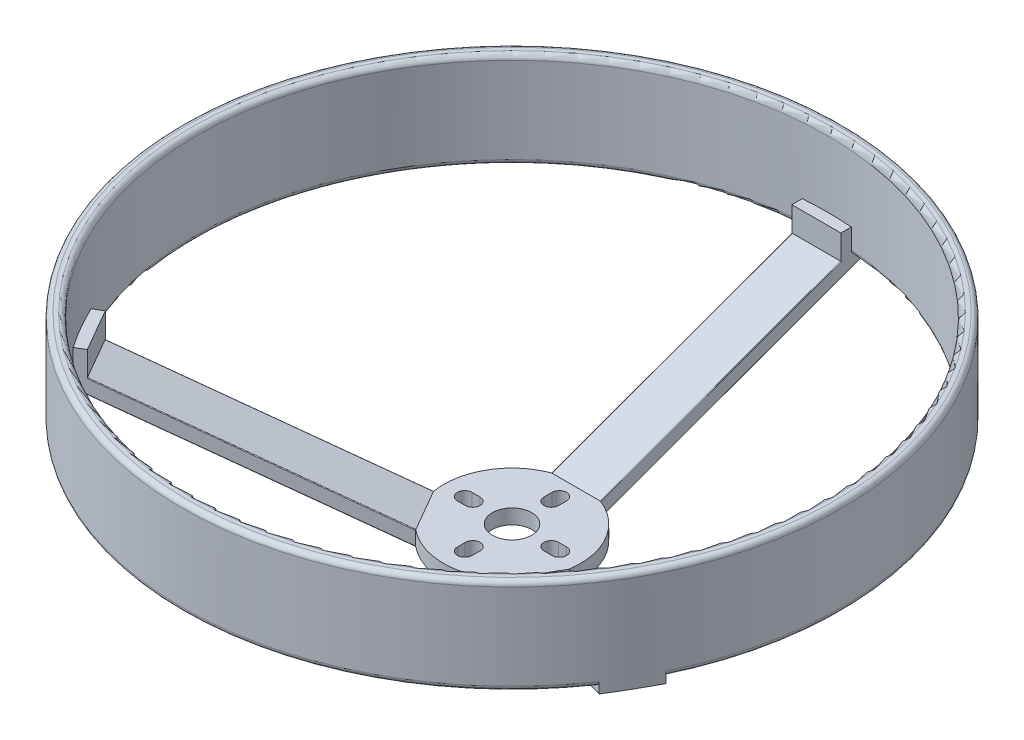
from build123d import *

# Parameters (mm, degrees)
SKETCH1_R               = 13.95
BOSS_EXTRUDE1_DEPTH     = 1.5
SKETCH2_R               = 4
CUT_EXTRUDE1_DEPTH      = 20.955074542581894
SKETCH3_R               = 1.4999999999999987
SKETCH3_R_2             = 1.5000000000000002
SKETCH3_R_3             = 1.4999999999999998
SKETCH3_W               = 10
SKETCH3_H               = 9.999999999999998
CUT_EXTRUDE2_DEPTH      = 20.955074542581894
CIRPATTERN1_COUNT       = 3
SKETCH6_R               = 100
CUT_EXTRUDE3_DEPTH      = 7.5
SKETCH7_R               = 70.00000000000001
SKETCH7_R_2             = 64.31
BOSS_EXTRUDE2_DEPTH     = 7
BOSS_EXTRUDE3_DEPTH     = 7
FILLET2_R               = 0.125
CUT_EXTRUDE4_START      = -7
CUT_EXTRUDE4_DEPTH      = 7
CUT_EXTRUDE5_DEPTH      = 103.99412000675751
CUT_EXTRUDE5_DEPTH_BACK = 103.99412000675751
SKETCH14_R              = 67.13
SKETCH15_R              = 67.13
SKETCH15_R_2            = 64.31
BOSS_EXTRUDE4_DEPTH     = 12.5
BOSS_EXTRUDE5_DEPTH     = 5
FILLET3_R               = 1
FILLET4_R               = 1
CUT_EXTRUDE6_DEPTH      = 103.00993873792338
CUT_EXTRUDE6_DEPTH_BACK = 103.00993873792338
SKETCH17_R              = 1.4999999999999993
SKETCH17_R_2            = 1.4999999999999987
SKETCH17_R_3            = 1.5000000000000293
SKETCH17_R_4            = 1.5000000000000002
SKETCH17_R_5            = 1.5000000000000078
SKETCH17_R_6            = 1.5
SKETCH17_R_7            = 1.4999999999999996
SKETCH17_R_8            = 1.4999999999999991


with BuildPart() as part:
    # Sketch1 → Boss-Extrude1 (new, symmetric)
    with BuildSketch(Plane(origin=(0, 0, 0), x_dir=(1, 0, 0), z_dir=(0, 1, 0))):
        with Locations(Location((0, 0, 0), (0, 0, 270))):
            Circle(SKETCH1_R)
    extrude(amount=BOSS_EXTRUDE1_DEPTH, both=True)

    # Sketch2 → Cut-Extrude1 (cut, through all)
    with BuildSketch(Plane(origin=(0, 1.5, 0), x_dir=(1, 0, 0), z_dir=(0, 1, 0))):
        with Locations(Location((0, 0, 0), (0, 0, 270))):
            Circle(SKETCH2_R)
    extrude(amount=-CUT_EXTRUDE1_DEPTH, mode=Mode.SUBTRACT)

    # Sketch3 → Cut-Extrude2 (cut, through all)
    with BuildSketch(Plane(origin=(0, 1.5, 0), x_dir=(1, 0, 0), z_dir=(0, 1, 0))):
        with Locations(Location((-9.63, 0, 0), (0, 0, 270))):
            Circle(SKETCH3_R)
        with Locations(Location((0, -8, 0), (0, 0, 270))):
            Circle(SKETCH3_R_2)
        with Locations(Location((0, 8, 0), (0, 0, 270))):
            Circle(SKETCH3_R_3)
        with Locations(Location((9.63, 0, 0), (0, 0, 270))):
            Circle(SKETCH3_R)
        with Locations((0, 18.023152460138057)):
            Rectangle(SKETCH3_W, SKETCH3_H)
        Polygon((13.778380867837367, -2.181449211146851), (8.778380867837354, -10.841703248991234), (17.43863490568173, -15.841703248991243), (22.43863490568175, -7.181449211146856), align=None)
        Polygon((-13.778380867837367, -2.181449211146851), (-8.778380867837354, -10.841703248991234), (-17.43863490568173, -15.841703248991246), (-22.438634905681745, -7.181449211146867), align=None)
    extrude(amount=-CUT_EXTRUDE2_DEPTH, mode=Mode.SUBTRACT)

    # Sweep1: sweep along a path in Sketch4
    with BuildLine(Plane(origin=(0, 0, 0), x_dir=(0, 0, -1), z_dir=(1, 0, 0))) as sweep1_path:
        Line((13.023152460138059, -1.5), (82.60294999917723, 23.824975210479074))
    # Sketch5 → Sweep1 (sweep)
    with BuildSketch(Plane(origin=(0, 0, -13.023152460138059), x_dir=(-1, 0, 0), z_dir=(0, 0, -1))):
        Polygon((5, 1.5), (-5, 1.5), (-4.999999999999998, -1.5), (5, -1.5), align=None)
    sweep1 = sweep(path=sweep1_path.line)

    # CirPattern1: Sweep1 ×3 about axis
    cirpattern1_axis = Axis((-3.73e-15, 0, 7.27e-15), (0, 1, 0))
    for i in range(1, CIRPATTERN1_COUNT):
        add(sweep1.rotate(cirpattern1_axis, i * 360 / CIRPATTERN1_COUNT))

    # Sketch6 → Cut-Extrude3 (cut)
    with BuildSketch(Plane(origin=(2.6e-15, 26.824975210479078, -7.5e-16), x_dir=(1, -1.2e-16, 0), z_dir=(1.2e-16, 1, -4e-17))):
        Circle(SKETCH6_R)
    extrude(amount=-CUT_EXTRUDE3_DEPTH, mode=Mode.SUBTRACT)

    # Sketch7 → Boss-Extrude2 (add)
    with BuildSketch(Plane(origin=(2.34e-15, 19.32497521047908, -8.1e-16), x_dir=(1, -1.2e-16, 0), z_dir=(1.2e-16, 1, -4e-17))):
        with Locations(Location((0, 0, 0), (0, 0, 334.096043758))):
            Circle(SKETCH7_R)
        with Locations(Location((0, 0, 0), (0, 0, 334.459155717))):
            Circle(SKETCH7_R_2, mode=Mode.SUBTRACT)
    extrude(amount=BOSS_EXTRUDE2_DEPTH)

    # Sketch8 → Boss-Extrude3 (add)
    with BuildSketch(Plane(origin=(2.34e-15, 19.32497521047908, -8.1e-16), x_dir=(1, -1.2e-16, 0), z_dir=(1.2e-16, 1, -4e-17))):
        with BuildLine():
            Line((-62.966933112239, -30.58047309050046), (-63.32901953974998, -30.78952378689385))
            Line((-63.32901953974998, -30.78952378689385), (-58.32901953974994, -39.44977782473821))
            Line((-58.32901953974994, -39.44977782473821), (-57.96693311223896, -39.24072712834482))
            ThreePointArc((-57.96693311223896, -39.24072712834482), (-60.62177826491057, -35.00000000000027), (-62.966933112239, -30.58047309050046))
        make_face()
        with BuildLine():
            Line((-56.19086381503456, -26.668307657711885), (-58.02550832725429, -27.72754016070923))
            ThreePointArc((-58.02550832725429, -27.72754016070923), (-55.6940937173771, -32.15500000000027), (-53.025508327254265, -36.3877941985536))
            Line((-53.025508327254265, -36.3877941985536), (-51.190863815034525, -35.328561695556246))
            Line((-51.190863815034525, -35.328561695556246), (-56.19086381503456, -26.668307657711885))
        make_face()
        with BuildLine():
            Line((4.999999999999997, 61.996869353267606), (4.999999999999996, 64.11533435926229))
            ThreePointArc((4.999999999999996, 64.11533435926229), (3.94e-15, 64.31), (-5.000000000000003, 64.1153343592623))
            Line((-5.000000000000003, 64.1153343592623), (-5.000000000000003, 61.996869353267606))
            Line((-5.000000000000003, 61.996869353267606), (4.999999999999997, 61.996869353267606))
        make_face()
        with BuildLine():
            Line((4.999999999999997, 69.82120021884472), (4.999999999999996, 70.23930161163146))
            Line((4.999999999999996, 70.23930161163146), (-5.0000000000000036, 70.23930161163146))
            Line((-5.0000000000000036, 70.23930161163146), (-5.000000000000003, 69.82120021884472))
            ThreePointArc((-5.000000000000003, 69.82120021884472), (4.29e-15, 70.00000000000001), (4.999999999999997, 69.82120021884472))
        make_face()
        with BuildLine():
            Line((57.96693311223951, -39.24072712834403), (58.32901953975044, -39.44977782473735))
            Line((58.32901953975044, -39.44977782473735), (63.32901953975037, -30.789523786892925))
            Line((63.32901953975037, -30.789523786892925), (62.96693311223943, -30.58047309049959))
            ThreePointArc((62.96693311223943, -30.58047309049959), (60.62177826491105, -34.99999999999945), (57.96693311223951, -39.24072712834403))
        make_face()
        with BuildLine():
            Line((51.19086381503499, -35.32856169555552), (53.02550832725476, -36.38779419855285))
            ThreePointArc((53.02550832725476, -36.38779419855285), (55.69409371737755, -32.15499999999948), (58.0255083272547, -27.727540160708426))
            Line((58.0255083272547, -27.727540160708426), (56.190863815034895, -26.668307657711075))
            Line((56.190863815034895, -26.668307657711075), (51.19086381503499, -35.32856169555552))
        make_face()
    extrude(amount=BOSS_EXTRUDE3_DEPTH)

    # Fillet2
    # the kernel refuses this fillet: 0.125 mm, written as the material it takes off along each edge
    with BuildSketch(Plane(origin=(-5, 1.3931187052107246, -12.729498516142453), x_dir=(1, 1.57e-15, 5.7e-16), z_dir=(0, 0.34202014332566916, -0.9396926207859083))) as fillet2_piece_1_section:
        with BuildLine():
            CenterArc((FILLET2_R, FILLET2_R), FILLET2_R, 180.00000000000085, 89.9999999999992)
            Line((-2.1e-16, FILLET2_R), (0, 0))
            Line((0, 0), (FILLET2_R, 0))
        make_face()
    fillet2_piece_1 = extrude(amount=52.74174095319662, mode=Mode.PRIVATE)
    fillet2_piece_1 = split(fillet2_piece_1, bisect_by=Plane(origin=(-4.98919132777138, 1.5, -13.108384860201912), z_dir=(0, -1, 0)), keep=Keep.TOP, mode=Mode.PRIVATE)
    fillet2_piece_1 = fillet2_piece_1 - Plane(origin=(0, 1.470483975860823, 0), x_dir=(-1.8e-16, 0, 1), z_dir=(0, 1, 0)) * Cylinder(13.95, 106, mode=Mode.PRIVATE)
    add(fillet2_piece_1, mode=Mode.SUBTRACT)
    with BuildSketch(Plane(origin=(-5, 1.3931187052107246, -12.729498516142453), x_dir=(1, 1.57e-15, 5.7e-16), z_dir=(0, 0.34202014332566916, -0.9396926207859083))) as fillet2_piece_2_section:
        with BuildLine():
            CenterArc((FILLET2_R, FILLET2_R), FILLET2_R, 180.00000000000085, 89.9999999999992)
            Line((-2.1e-16, FILLET2_R), (0, 0))
            Line((0, 0), (FILLET2_R, 0))
        make_face()
    fillet2_piece_2 = extrude(amount=52.74174095319662, mode=Mode.PRIVATE)
    fillet2_piece_2 = split(fillet2_piece_2, bisect_by=Plane(origin=(-4.92233777010117, 1.5, -13.038493601413808), z_dir=(0, 1, 0)), keep=Keep.TOP, mode=Mode.PRIVATE)
    fillet2_piece_2 = fillet2_piece_2 & Plane(origin=(0, 1.505160465180015, 0), x_dir=(-1.8e-16, 0, 1), z_dir=(0, 1, 0)) * Cylinder(13.95, 106, mode=Mode.PRIVATE)
    add(fillet2_piece_2, mode=Mode.SUBTRACT)
    with BuildSketch(Plane(origin=(-5, 1.3931187052107246, -12.729498516142453), x_dir=(1, 1.57e-15, 5.7e-16), z_dir=(0, 0.34202014332566916, -0.9396926207859083))) as fillet2_piece_3_section:
        with BuildLine():
            CenterArc((FILLET2_R, FILLET2_R), FILLET2_R, 180.00000000000085, 89.9999999999992)
            Line((-2.1e-16, FILLET2_R), (0, 0))
            Line((0, 0), (FILLET2_R, 0))
        make_face()
    fillet2_piece_3 = extrude(amount=52.74174095319662, mode=Mode.PRIVATE)
    fillet2_piece_3 = split(fillet2_piece_3, bisect_by=Plane(origin=(-4.971679062367054, 1.5, -37.55335887721227), z_dir=(0, 1, 0)), keep=Keep.TOP, mode=Mode.PRIVATE)
    fillet2_piece_3 = split(fillet2_piece_3, bisect_by=Plane(origin=(-4.971679062367053, 10.398193142999142, -61.996869353267606), z_dir=(0, 4e-17, 1)), keep=Keep.TOP, mode=Mode.PRIVATE)
    fillet2_piece_3 = fillet2_piece_3 - Plane(origin=(0, 10.398193142999144, 0), x_dir=(-1.8e-16, 0, 1), z_dir=(0, 1, 0)) * Cylinder(13.95, 106, mode=Mode.PRIVATE)
    add(fillet2_piece_3, mode=Mode.SUBTRACT)
    with BuildSketch(Plane(origin=(5, 1.3931187052107246, -12.729498516142453), x_dir=(-1, 1.57e-15, 5.7e-16), z_dir=(0, 0.34202014332566916, -0.9396926207859083))) as fillet2_piece_4_section:
        with BuildLine():
            CenterArc((FILLET2_R, -FILLET2_R), FILLET2_R, 89.99999999999991, 90)
            Line((-2.1e-16, -FILLET2_R), (0, 0))
            Line((0, 0), (FILLET2_R, 0))
        make_face()
    fillet2_piece_4 = extrude(amount=52.74174095319662, mode=Mode.PRIVATE)
    fillet2_piece_4 = split(fillet2_piece_4, bisect_by=Plane(origin=(4.989191288768681, 1.5, -13.108384765845637), z_dir=(0, -1, 0)), keep=Keep.TOP, mode=Mode.PRIVATE)
    fillet2_piece_4 = fillet2_piece_4 - Plane(origin=(0, 1.4704838861363334, 0), x_dir=(-1.8e-16, 0, 1), z_dir=(0, 1, 0)) * Cylinder(13.95, 106, mode=Mode.PRIVATE)
    add(fillet2_piece_4, mode=Mode.SUBTRACT)
    with BuildSketch(Plane(origin=(5, 1.3931187052107246, -12.729498516142453), x_dir=(-1, 1.57e-15, 5.7e-16), z_dir=(0, 0.34202014332566916, -0.9396926207859083))) as fillet2_piece_5_section:
        with BuildLine():
            CenterArc((FILLET2_R, -FILLET2_R), FILLET2_R, 89.99999999999991, 90)
            Line((-2.1e-16, -FILLET2_R), (0, 0))
            Line((0, 0), (FILLET2_R, 0))
        make_face()
    fillet2_piece_5 = extrude(amount=52.74174095319662, mode=Mode.PRIVATE)
    fillet2_piece_5 = split(fillet2_piece_5, bisect_by=Plane(origin=(4.922337773960496, 1.5, -13.038493603324556), z_dir=(0, 1, 0)), keep=Keep.TOP, mode=Mode.PRIVATE)
    fillet2_piece_5 = fillet2_piece_5 & Plane(origin=(0, 1.505160464078921, 0), x_dir=(-1.8e-16, 0, 1), z_dir=(0, 1, 0)) * Cylinder(13.95, 106, mode=Mode.PRIVATE)
    add(fillet2_piece_5, mode=Mode.SUBTRACT)
    with BuildSketch(Plane(origin=(5, 1.3931187052107246, -12.729498516142453), x_dir=(-1, 1.57e-15, 5.7e-16), z_dir=(0, 0.34202014332566916, -0.9396926207859083))) as fillet2_piece_6_section:
        with BuildLine():
            CenterArc((FILLET2_R, -FILLET2_R), FILLET2_R, 89.99999999999991, 90)
            Line((-2.1e-16, -FILLET2_R), (0, 0))
            Line((0, 0), (FILLET2_R, 0))
        make_face()
    fillet2_piece_6 = extrude(amount=52.74174095319662, mode=Mode.PRIVATE)
    fillet2_piece_6 = split(fillet2_piece_6, bisect_by=Plane(origin=(4.971679061604045, 1.5, -37.55335844838123), z_dir=(0, 1, 0)), keep=Keep.TOP, mode=Mode.PRIVATE)
    fillet2_piece_6 = fillet2_piece_6 - Plane(origin=(0, 10.398192987204272, 0), x_dir=(-1.8e-16, 0, 1), z_dir=(0, 1, 0)) * Cylinder(13.95, 106, mode=Mode.PRIVATE)
    fillet2_piece_6 = split(fillet2_piece_6, bisect_by=Plane(origin=(4.9716790616040445, 10.398192987204268, -61.996869353267606), z_dir=(0, 4e-17, 1)), keep=Keep.TOP, mode=Mode.PRIVATE)
    add(fillet2_piece_6, mode=Mode.SUBTRACT)
    with BuildSketch(Plane(origin=(4.999999999999998, -1.6068812947892759, -12.729498516142453), x_dir=(-1, 3.14e-15, 1.14e-15), z_dir=(0, 0.34202014332566916, -0.9396926207859083))) as fillet2_piece_7_section:
        with BuildLine():
            CenterArc((FILLET2_R, FILLET2_R), FILLET2_R, 180.0000000000001, 89.99999999999972)
            Line((4.2e-16, FILLET2_R), (0, 0))
            Line((0, 0), (FILLET2_R, 0))
        make_face()
    fillet2_piece_7 = extrude(amount=61.51315415368586, mode=Mode.PRIVATE)
    fillet2_piece_7 = fillet2_piece_7 - Plane(origin=(0, 8.996247599581329, 0), x_dir=(-1.8e-16, 0, 1), z_dir=(0, 1, 0)) * Cylinder(13.95, 124, mode=Mode.PRIVATE)
    add(fillet2_piece_7, mode=Mode.SUBTRACT)
    with BuildSketch(Plane(origin=(-5, -1.6068812947892757, -12.729498516142453), x_dir=(1, 1.57e-15, 5.7e-16), z_dir=(0, 0.34202014332566916, -0.9396926207859083))) as fillet2_piece_8_section:
        with BuildLine():
            CenterArc((FILLET2_R, -FILLET2_R), FILLET2_R, 90.0000000000001, 90.00000000000045)
            Line((2.1e-16, -FILLET2_R), (0, 0))
            Line((0, 0), (FILLET2_R, 0))
        make_face()
    fillet2_piece_8 = extrude(amount=61.51315415368586, mode=Mode.PRIVATE)
    fillet2_piece_8 = fillet2_piece_8 - Plane(origin=(0, 8.996244984168513, 0), x_dir=(-1.8e-16, 0, 1), z_dir=(0, 1, 0)) * Cylinder(13.95, 124, mode=Mode.PRIVATE)
    add(fillet2_piece_8, mode=Mode.SUBTRACT)
    with BuildSketch(Plane(origin=(-8.52406909241569, 1.393118705210723, 10.694876276993423), x_dir=(-0.2961981327260264, -0.9396926207859082, 0.17101007166283072), z_dir=(-0.8137976813493737, 0.34202014332566916, 0.46984631039295394))) as fillet2_piece_9_section:
        with BuildLine():
            CenterArc((FILLET2_R, -FILLET2_R), FILLET2_R, 90.0000000000003, 90.00000000000006)
            Line((7.7e-16, -FILLET2_R), (0, 0))
            Line((0, 0), (FILLET2_R, 0))
        make_face()
    fillet2_piece_9 = extrude(amount=52.74174095319667, mode=Mode.PRIVATE)
    fillet2_piece_9 = fillet2_piece_9 & Plane(origin=(0, 1.505160465125439, 0), x_dir=(-1.8e-16, 0, 1), z_dir=(0, 1, 0)) * Cylinder(13.95, 106, mode=Mode.PRIVATE)
    fillet2_piece_9 = split(fillet2_piece_9, bisect_by=Plane(origin=(-8.830497788467238, 1.5, 10.782116361851354), z_dir=(0, 1, 0)), keep=Keep.TOP, mode=Mode.PRIVATE)
    add(fillet2_piece_9, mode=Mode.SUBTRACT)
    with BuildSketch(Plane(origin=(-8.52406909241569, 1.393118705210723, 10.694876276993423), x_dir=(-0.2961981327260264, -0.9396926207859082, 0.17101007166283072), z_dir=(-0.8137976813493737, 0.34202014332566916, 0.46984631039295394))) as fillet2_piece_10_section:
        with BuildLine():
            CenterArc((FILLET2_R, -FILLET2_R), FILLET2_R, 90.0000000000003, 90.00000000000006)
            Line((7.7e-16, -FILLET2_R), (0, 0))
            Line((0, 0), (FILLET2_R, 0))
        make_face()
    fillet2_piece_10 = extrude(amount=52.74174095319667, mode=Mode.PRIVATE)
    fillet2_piece_10 = fillet2_piece_10 - Plane(origin=(0, 1.470484023730546, 0), x_dir=(-1.8e-16, 0, 1), z_dir=(0, 1, 0)) * Cylinder(13.95, 106, mode=Mode.PRIVATE)
    fillet2_piece_10 = split(fillet2_piece_10, bisect_by=Plane(origin=(-8.857598660070193, 1.5, 10.874958902155365), z_dir=(0, -1, 0)), keep=Keep.TOP, mode=Mode.PRIVATE)
    add(fillet2_piece_10, mode=Mode.SUBTRACT)
    with BuildSketch(Plane(origin=(-8.52406909241569, 1.393118705210723, 10.694876276993423), x_dir=(-0.2961981327260264, -0.9396926207859082, 0.17101007166283072), z_dir=(-0.8137976813493737, 0.34202014332566916, 0.46984631039295394))) as fillet2_piece_11_section:
        with BuildLine():
            CenterArc((FILLET2_R, -FILLET2_R), FILLET2_R, 90.0000000000003, 90.00000000000006)
            Line((7.7e-16, -FILLET2_R), (0, 0))
            Line((0, 0), (FILLET2_R, 0))
        make_face()
    fillet2_piece_11 = extrude(amount=52.74174095319667, mode=Mode.PRIVATE)
    fillet2_piece_11 = fillet2_piece_11 - Plane(origin=(0, 10.39819312312159, 0), x_dir=(-1.8e-16, 0, 1), z_dir=(0, 1, 0)) * Cylinder(13.95, 106, mode=Mode.PRIVATE)
    fillet2_piece_11 = split(fillet2_piece_11, bisect_by=Plane(origin=(-30.03632320741014, 1.5, 23.082279778424425), z_dir=(0, 1, 0)), keep=Keep.TOP, mode=Mode.PRIVATE)
    fillet2_piece_11 = split(fillet2_piece_11, bisect_by=Plane(origin=(-51.20502428419945, 10.398193123121592, 35.30403504350358), z_dir=(0.8660254037844365, 0, -0.5000000000000039)), keep=Keep.TOP, mode=Mode.PRIVATE)
    add(fillet2_piece_11, mode=Mode.SUBTRACT)
    with BuildSketch(Plane(origin=(-13.524069092415694, 1.3931187052107243, 2.0346222391490354), x_dir=(0.5000000000000008, 3.1165301514669253e-15, 0.8660254037844383), z_dir=(-0.8137976813493737, 0.34202014332566916, 0.46984631039295394))) as fillet2_piece_12_section:
        with BuildLine():
            CenterArc((FILLET2_R, -FILLET2_R), FILLET2_R, 89.99999999999997, 89.99999999999918)
            Line((-1.87e-15, -FILLET2_R), (0, 0))
            Line((0, 0), (FILLET2_R, 0))
        make_face()
    fillet2_piece_12 = extrude(amount=52.74174095319667, mode=Mode.PRIVATE)
    fillet2_piece_12 = split(fillet2_piece_12, bisect_by=Plane(origin=(-13.846789875580967, 1.5, 2.2334259907132044), z_dir=(0, -1, 0)), keep=Keep.TOP, mode=Mode.PRIVATE)
    fillet2_piece_12 = fillet2_piece_12 - Plane(origin=(0, 1.470483895441978, 0), x_dir=(-1.8e-16, 0, 1), z_dir=(0, 1, 0)) * Cylinder(13.95, 106, mode=Mode.PRIVATE)
    add(fillet2_piece_12, mode=Mode.SUBTRACT)
    with BuildSketch(Plane(origin=(-13.524069092415694, 1.3931187052107243, 2.0346222391490354), x_dir=(0.5000000000000008, 3.1165301514669253e-15, 0.8660254037844383), z_dir=(-0.8137976813493737, 0.34202014332566916, 0.46984631039295394))) as fillet2_piece_13_section:
        with BuildLine():
            CenterArc((FILLET2_R, -FILLET2_R), FILLET2_R, 89.99999999999997, 89.99999999999918)
            Line((-1.87e-15, -FILLET2_R), (0, 0))
            Line((0, 0), (FILLET2_R, 0))
        make_face()
    fillet2_piece_13 = extrude(amount=52.74174095319667, mode=Mode.PRIVATE)
    fillet2_piece_13 = split(fillet2_piece_13, bisect_by=Plane(origin=(-13.752835574425907, 1.5, 2.2563772427188282), z_dir=(0, 1, 0)), keep=Keep.TOP, mode=Mode.PRIVATE)
    fillet2_piece_13 = fillet2_piece_13 & Plane(origin=(0, 1.5051604641850476, 0), x_dir=(-1.8e-16, 0, 1), z_dir=(0, 1, 0)) * Cylinder(13.95, 106, mode=Mode.PRIVATE)
    add(fillet2_piece_13, mode=Mode.SUBTRACT)
    with BuildSketch(Plane(origin=(-13.524069092415694, 1.3931187052107243, 2.0346222391490354), x_dir=(0.5000000000000008, 3.1165301514669253e-15, 0.8660254037844383), z_dir=(-0.8137976813493737, 0.34202014332566916, 0.46984631039295394))) as fillet2_piece_14_section:
        with BuildLine():
            CenterArc((FILLET2_R, -FILLET2_R), FILLET2_R, 89.99999999999997, 89.99999999999918)
            Line((-1.87e-15, -FILLET2_R), (0, 0))
            Line((0, 0), (FILLET2_R, 0))
        make_face()
    fillet2_piece_14 = extrude(amount=52.74174095319667, mode=Mode.PRIVATE)
    fillet2_piece_14 = split(fillet2_piece_14, bisect_by=Plane(origin=(-35.008001388564196, 1.5, 14.471078535566715), z_dir=(0, 1, 0)), keep=Keep.TOP, mode=Mode.PRIVATE)
    fillet2_piece_14 = split(fillet2_piece_14, bisect_by=Plane(origin=(-56.17670334619546, 10.398192752477222, 26.692834309200208), z_dir=(0.8660254037844365, 0, -0.5000000000000039)), keep=Keep.TOP, mode=Mode.PRIVATE)
    fillet2_piece_14 = fillet2_piece_14 - Plane(origin=(0, 10.398192752477218, 0), x_dir=(-1.8e-16, 0, 1), z_dir=(0, 1, 0)) * Cylinder(13.95, 106, mode=Mode.PRIVATE)
    add(fillet2_piece_14, mode=Mode.SUBTRACT)
    with BuildSketch(Plane(origin=(-13.524069092415694, -1.6068812947892763, 2.034622239149034), x_dir=(0.4999999999999999, 0, 0.8660254037844387), z_dir=(-0.8137976813493737, 0.34202014332566916, 0.46984631039295394))) as fillet2_piece_15_section:
        with BuildLine():
            CenterArc((FILLET2_R, FILLET2_R), FILLET2_R, 179.9999999999991, 90.00000000000102)
            Line((-1.2e-15, FILLET2_R), (0, 0))
            Line((0, 0), (FILLET2_R, 0))
        make_face()
    fillet2_piece_15 = extrude(amount=61.513154153685896, mode=Mode.PRIVATE)
    fillet2_piece_15 = fillet2_piece_15 - Plane(origin=(0, 8.996247599581132, 0), x_dir=(-1.8e-16, 0, 1), z_dir=(0, 1, 0)) * Cylinder(13.95, 124, mode=Mode.PRIVATE)
    add(fillet2_piece_15, mode=Mode.SUBTRACT)
    with BuildSketch(Plane(origin=(-8.524069092415683, -1.6068812947892805, 10.69487627699342), x_dir=(0.2961981327260264, 0.9396926207859082, -0.17101007166283072), z_dir=(-0.8137976813493737, 0.34202014332566916, 0.46984631039295394))) as fillet2_piece_16_section:
        with BuildLine():
            CenterArc((FILLET2_R, FILLET2_R), FILLET2_R, 180.00000000000028, 90)
            Line((-6.5e-16, FILLET2_R), (0, 0))
            Line((0, 0), (FILLET2_R, 0))
        make_face()
    fillet2_piece_16 = extrude(amount=61.51315415368593, mode=Mode.PRIVATE)
    fillet2_piece_16 = fillet2_piece_16 - Plane(origin=(0, 8.996244980615106, 0), x_dir=(-1.8e-16, 0, 1), z_dir=(0, 1, 0)) * Cylinder(13.95, 124, mode=Mode.PRIVATE)
    add(fillet2_piece_16, mode=Mode.SUBTRACT)
    with BuildSketch(Plane(origin=(13.524069092415672, 1.3931187052107226, 2.034622239149053), x_dir=(-0.5000000000000001, -1.377246394826983e-15, 0.8660254037844387), z_dir=(0.8137976813493734, 0.34202014332566916, 0.4698463103929546))) as fillet2_piece_17_section:
        with BuildLine():
            CenterArc((FILLET2_R, FILLET2_R), FILLET2_R, 179.9999999999995, 90.00000000000028)
            Line((-2.5e-16, FILLET2_R), (0, 0))
            Line((0, 0), (FILLET2_R, 0))
        make_face()
    fillet2_piece_17 = extrude(amount=52.74174095319664, mode=Mode.PRIVATE)
    fillet2_piece_17 = split(fillet2_piece_17, bisect_by=Plane(origin=(13.846789993785876, 1.5, 2.2334259958364804), z_dir=(0, -1, 0)), keep=Keep.TOP, mode=Mode.PRIVATE)
    fillet2_piece_17 = fillet2_piece_17 - Plane(origin=(0, 1.470484018812807, 0), x_dir=(-1.8e-16, 0, 1), z_dir=(0, 1, 0)) * Cylinder(13.95, 106, mode=Mode.PRIVATE)
    add(fillet2_piece_17, mode=Mode.SUBTRACT)
    with BuildSketch(Plane(origin=(13.524069092415672, 1.3931187052107226, 2.034622239149053), x_dir=(-0.5000000000000001, -1.377246394826983e-15, 0.8660254037844387), z_dir=(0.8137976813493734, 0.34202014332566916, 0.4698463103929546))) as fillet2_piece_18_section:
        with BuildLine():
            CenterArc((FILLET2_R, FILLET2_R), FILLET2_R, 179.9999999999995, 90.00000000000028)
            Line((-2.5e-16, FILLET2_R), (0, 0))
            Line((0, 0), (FILLET2_R, 0))
        make_face()
    fillet2_piece_18 = extrude(amount=52.74174095319664, mode=Mode.PRIVATE)
    fillet2_piece_18 = split(fillet2_piece_18, bisect_by=Plane(origin=(13.752835571522573, 1.5, 2.256377245084684), z_dir=(0, 1, 0)), keep=Keep.TOP, mode=Mode.PRIVATE)
    fillet2_piece_18 = fillet2_piece_18 & Plane(origin=(0, 1.505160464853067, 0), x_dir=(-1.8e-16, 0, 1), z_dir=(0, 1, 0)) * Cylinder(13.95, 106, mode=Mode.PRIVATE)
    add(fillet2_piece_18, mode=Mode.SUBTRACT)
    with BuildSketch(Plane(origin=(13.524069092415672, 1.3931187052107226, 2.034622239149053), x_dir=(-0.5000000000000001, -1.377246394826983e-15, 0.8660254037844387), z_dir=(0.8137976813493734, 0.34202014332566916, 0.4698463103929546))) as fillet2_piece_19_section:
        with BuildLine():
            CenterArc((FILLET2_R, FILLET2_R), FILLET2_R, 179.9999999999995, 90.00000000000028)
            Line((-2.5e-16, FILLET2_R), (0, 0))
            Line((0, 0), (FILLET2_R, 0))
        make_face()
    fillet2_piece_19 = extrude(amount=52.74174095319664, mode=Mode.PRIVATE)
    fillet2_piece_19 = split(fillet2_piece_19, bisect_by=Plane(origin=(35.00800239269441, 1.5, 14.471079115226706), z_dir=(0, 1, 0)), keep=Keep.TOP, mode=Mode.PRIVATE)
    fillet2_piece_19 = split(fillet2_piece_19, bisect_by=Plane(origin=(56.17670334622796, 10.398193175059, 26.69283430914368), z_dir=(-0.8660254037844441, 0, -0.4999999999999905)), keep=Keep.TOP, mode=Mode.PRIVATE)
    fillet2_piece_19 = fillet2_piece_19 - Plane(origin=(0, 10.398193175059003, 0), x_dir=(-1.8e-16, 0, 1), z_dir=(0, 1, 0)) * Cylinder(13.95, 106, mode=Mode.PRIVATE)
    add(fillet2_piece_19, mode=Mode.SUBTRACT)
    with BuildSketch(Plane(origin=(8.52406909241568, 1.3931187052107248, 10.694876276993437), x_dir=(0.2961981327260245, -0.9396926207859082, 0.17101007166283402), z_dir=(0.8137976813493734, 0.34202014332566916, 0.4698463103929546))) as fillet2_piece_20_section:
        with BuildLine():
            CenterArc((FILLET2_R, FILLET2_R), FILLET2_R, 180, 89.99999999999989)
            Line((-8.6e-16, FILLET2_R), (0, 0))
            Line((0, 0), (FILLET2_R, 0))
        make_face()
    fillet2_piece_20 = extrude(amount=52.741740953196626, mode=Mode.PRIVATE)
    fillet2_piece_20 = fillet2_piece_20 & Plane(origin=(0, 1.5051604642067382, 0), x_dir=(-1.8e-16, 0, 1), z_dir=(0, 1, 0)) * Cylinder(13.95, 106, mode=Mode.PRIVATE)
    fillet2_piece_20 = split(fillet2_piece_20, bisect_by=Plane(origin=(8.830497787612382, 1.5, 10.782116365184846), z_dir=(0, 1, 0)), keep=Keep.TOP, mode=Mode.PRIVATE)
    add(fillet2_piece_20, mode=Mode.SUBTRACT)
    with BuildSketch(Plane(origin=(8.52406909241568, 1.3931187052107248, 10.694876276993437), x_dir=(0.2961981327260245, -0.9396926207859082, 0.17101007166283402), z_dir=(0.8137976813493734, 0.34202014332566916, 0.4698463103929546))) as fillet2_piece_21_section:
        with BuildLine():
            CenterArc((FILLET2_R, FILLET2_R), FILLET2_R, 180, 89.99999999999989)
            Line((-8.6e-16, FILLET2_R), (0, 0))
            Line((0, 0), (FILLET2_R, 0))
        make_face()
    fillet2_piece_21 = extrude(amount=52.741740953196626, mode=Mode.PRIVATE)
    fillet2_piece_21 = fillet2_piece_21 - Plane(origin=(0, 1.4704838903148396, 0), x_dir=(-1.8e-16, 0, 1), z_dir=(0, 1, 0)) * Cylinder(13.95, 106, mode=Mode.PRIVATE)
    fillet2_piece_21 = split(fillet2_piece_21, bisect_by=Plane(origin=(8.857598576017248, 1.5, 10.874958790307534), z_dir=(0, -1, 0)), keep=Keep.TOP, mode=Mode.PRIVATE)
    add(fillet2_piece_21, mode=Mode.SUBTRACT)
    with BuildSketch(Plane(origin=(8.52406909241568, 1.3931187052107248, 10.694876276993437), x_dir=(0.2961981327260245, -0.9396926207859082, 0.17101007166283402), z_dir=(0.8137976813493734, 0.34202014332566916, 0.4698463103929546))) as fillet2_piece_22_section:
        with BuildLine():
            CenterArc((FILLET2_R, FILLET2_R), FILLET2_R, 180, 89.99999999999989)
            Line((-8.6e-16, FILLET2_R), (0, 0))
            Line((0, 0), (FILLET2_R, 0))
        make_face()
    fillet2_piece_22 = extrude(amount=52.741740953196626, mode=Mode.PRIVATE)
    fillet2_piece_22 = fillet2_piece_22 - Plane(origin=(0, 10.398193008763602, 0), x_dir=(-1.8e-16, 0, 1), z_dir=(0, 1, 0)) * Cylinder(13.95, 106, mode=Mode.PRIVATE)
    fillet2_piece_22 = split(fillet2_piece_22, bisect_by=Plane(origin=(30.036322934226504, 1.5, 23.08227962071921), z_dir=(0, 1, 0)), keep=Keep.TOP, mode=Mode.PRIVATE)
    fillet2_piece_22 = split(fillet2_piece_22, bisect_by=Plane(origin=(51.20502428419213, 10.398193008763599, 35.30403504351634), z_dir=(-0.8660254037844441, 0, -0.4999999999999905)), keep=Keep.TOP, mode=Mode.PRIVATE)
    add(fillet2_piece_22, mode=Mode.SUBTRACT)
    with BuildSketch(Plane(origin=(8.52406909241568, -1.6068812947892752, 10.694876276993437), x_dir=(-0.29619813272602835, 0.9396926207859084, -0.17101007166282742), z_dir=(0.8137976813493734, 0.34202014332566916, 0.4698463103929546))) as fillet2_piece_23_section:
        with BuildLine():
            CenterArc((FILLET2_R, -FILLET2_R), FILLET2_R, 89.99999999999947, 90.0000000000008)
            Line((1.37e-15, -FILLET2_R), (0, 0))
            Line((0, 0), (FILLET2_R, 0))
        make_face()
    fillet2_piece_23 = extrude(amount=61.51315415368587, mode=Mode.PRIVATE)
    fillet2_piece_23 = fillet2_piece_23 - Plane(origin=(0, 8.996247596047603, 0), x_dir=(-1.8e-16, 0, 1), z_dir=(0, 1, 0)) * Cylinder(13.95, 124, mode=Mode.PRIVATE)
    add(fillet2_piece_23, mode=Mode.SUBTRACT)
    with BuildSketch(Plane(origin=(13.524069092415676, -1.606881294789276, 2.0346222391490567), x_dir=(-0.5000000000000004, 0, 0.8660254037844385), z_dir=(0.8137976813493734, 0.34202014332566916, 0.4698463103929546))) as fillet2_piece_24_section:
        with BuildLine():
            CenterArc((FILLET2_R, -FILLET2_R), FILLET2_R, 89.99999999999984, 90.00000000000023)
            Line((-2.39e-15, -FILLET2_R), (0, 0))
            Line((0, 0), (FILLET2_R, 0))
        make_face()
    fillet2_piece_24 = extrude(amount=61.51315415368587, mode=Mode.PRIVATE)
    fillet2_piece_24 = fillet2_piece_24 - Plane(origin=(0, 8.996244984167342, 0), x_dir=(-1.8e-16, 0, 1), z_dir=(0, 1, 0)) * Cylinder(13.95, 124, mode=Mode.PRIVATE)
    add(fillet2_piece_24, mode=Mode.SUBTRACT)

    # Sketch13 → Cut-Extrude4 (cut)
    with BuildSketch(Plane(origin=(3.19e-15, 26.324975210479078, -1.11e-15), x_dir=(1, -1.2e-16, 0), z_dir=(1.2e-16, 1, -4e-17)).offset(CUT_EXTRUDE4_START)):
        with BuildLine():
            Line((4.999999999999997, 61.996869353267606), (4.999999999999996, 64.11533435926229))
            ThreePointArc((4.9999999999999964, 64.11533435926229), (-1.034e-14, 64.31), (-5.000000000000017, 64.11533435926229))
            Line((-5.00000000000001, 64.11533435926229), (-5.000000000000003, 61.996869353267606))
            Line((-5.000000000000003, 61.996869353267606), (4.999999999999997, 61.996869353267606))
        make_face()
        with BuildLine():
            ThreePointArc((53.02550832725474, -36.38779419855287), (55.69409371737755, -32.15499999999949), (58.02550832725466, -27.72754016070845))
            Line((58.025508327254684, -27.727540160708422), (56.190863815034895, -26.668307657711075))
            Line((56.190863815034895, -26.668307657711075), (51.19086381503499, -35.32856169555552))
            Line((51.19086381503499, -35.32856169555552), (53.02550832725476, -36.38779419855285))
        make_face()
        with BuildLine():
            Line((-56.19086381503456, -26.668307657711885), (-58.025508327254286, -27.727540160709232))
            ThreePointArc((-58.02550832725429, -27.72754016070923), (-55.69409371737711, -32.15500000000026), (-53.02550832725426, -36.38779419855358))
            Line((-53.02550832725426, -36.38779419855359), (-51.190863815034525, -35.328561695556246))
            Line((-51.190863815034525, -35.328561695556246), (-56.19086381503456, -26.668307657711885))
        make_face()
    extrude(amount=CUT_EXTRUDE4_DEPTH, mode=Mode.SUBTRACT)

    # Sketch14 → Cut-Extrude5 (cut, two sides: drawn at the far end of the back side and taken through both)
    with BuildSketch(Plane(origin=(3.19e-15, 26.324975210479078, -1.11e-15), x_dir=(1, -1.2e-16, 0), z_dir=(1.2e-16, 1, -4e-17)).offset(-CUT_EXTRUDE5_DEPTH_BACK)):
        with BuildLine():
            Line((-58.32901953974994, -39.44977782473821), (-57.96693311223896, -39.24072712834482))
            ThreePointArc((-57.96693311223896, -39.24072712834482), (4.7058e-13, -70.00000000000003), (57.96693311223951, -39.24072712834403))
            Line((57.96693311223951, -39.24072712834403), (58.32901953975044, -39.44977782473735))
            Line((58.32901953975044, -39.44977782473735), (63.32901953975037, -30.789523786892925))
            Line((63.32901953975037, -30.789523786892925), (62.96693311223942, -30.58047309049958))
            ThreePointArc((62.96693311223942, -30.58047309049958), (60.62177826491056, 35.000000000000284), (4.999999999999997, 69.82120021884472))
            Line((4.999999999999997, 69.82120021884472), (4.999999999999996, 70.23930161163146))
            Line((4.999999999999996, 70.23930161163146), (-5.0000000000000036, 70.23930161163146))
            Line((-5.0000000000000036, 70.23930161163146), (-5.000000000000003, 69.82120021884472))
            ThreePointArc((-5.000000000000003, 69.82120021884472), (-60.6217782649108, 34.99999999999987), (-62.966933112239, -30.58047309050046))
            Line((-62.966933112239, -30.58047309050046), (-63.32901953974998, -30.78952378689385))
            Line((-63.32901953974998, -30.78952378689385), (-58.32901953974994, -39.44977782473821))
        make_face()
        with Locations(Location((0, 0, 0), (0, 0, 180))):
            Circle(SKETCH14_R, mode=Mode.SUBTRACT)
    extrude(amount=CUT_EXTRUDE5_DEPTH + CUT_EXTRUDE5_DEPTH_BACK, mode=Mode.SUBTRACT)

    # Sketch15 → Boss-Extrude4 (add)
    with BuildSketch(Plane(origin=(3.19e-15, 26.324975210479078, -1.11e-15), x_dir=(1, -1.2e-16, 0), z_dir=(1.2e-16, 1, -4e-17))):
        with Locations(Location((0, 0, 0), (0, 0, 180))):
            Circle(SKETCH15_R)
        with Locations(Location((0, 0, 0), (0, 0, 334.459155717))):
            Circle(SKETCH15_R_2, mode=Mode.SUBTRACT)
    extrude(amount=BOSS_EXTRUDE4_DEPTH)

    # Sketch16 → Boss-Extrude5 (add)
    with BuildSketch(Plane(origin=(2.17e-15, 19.32497521047908, -8.7e-16), x_dir=(1, -1.1e-16, 0), z_dir=(1.1e-16, 1, -4e-17))):
        with BuildLine():
            Line((-56.19086381503456, -26.668307657711885), (-58.02550832725429, -27.727540160709225))
            ThreePointArc((-58.02550832725429, -27.727540160709225), (-55.6940937173771, -32.15500000000027), (-53.025508327254265, -36.3877941985536))
            Line((-53.025508327254265, -36.3877941985536), (-51.19086381503451, -35.328561695556246))
            Line((-51.19086381503451, -35.328561695556246), (-51.253363815034525, -35.2203085200832))
            Line((-51.253363815034525, -35.2203085200832), (-56.12836381503456, -26.77656083318494))
            Line((-56.12836381503456, -26.77656083318494), (-56.19086381503456, -26.668307657711885))
        make_face()
        with BuildLine():
            Line((51.19086381503499, -35.328561695555514), (53.02550832725477, -36.38779419855285))
            ThreePointArc((53.02550832725477, -36.38779419855285), (55.694093717377555, -32.15499999999948), (58.02550832725469, -27.72754016070842))
            Line((58.02550832725469, -27.72754016070842), (56.190863815034895, -26.668307657711075))
            Line((56.190863815034895, -26.668307657711075), (56.1283638150349, -26.77656083318414))
            Line((56.1283638150349, -26.77656083318414), (51.25336381503498, -35.22030852008246))
            Line((51.25336381503498, -35.22030852008246), (51.19086381503499, -35.328561695555514))
        make_face()
        with BuildLine():
            Line((4.999999999999997, 61.996869353267606), (4.9999999999999885, 64.11533435926229))
            ThreePointArc((4.9999999999999885, 64.11533435926229), (-1.017e-14, 64.31), (-5.000000000000003, 64.11533435926229))
            Line((-5.000000000000003, 64.11533435926229), (-5.000000000000003, 61.996869353267606))
            Line((-5.000000000000003, 61.996869353267606), (-4.875000000000003, 61.996869353267606))
            Line((-4.875000000000003, 61.996869353267606), (4.8749999999999964, 61.996869353267606))
            Line((4.8749999999999964, 61.996869353267606), (4.999999999999997, 61.996869353267606))
        make_face()
    extrude(amount=BOSS_EXTRUDE5_DEPTH)

    # Fillet3
    fillet3_edges = [part.edges().sort_by_distance(p)[0] for p in [
        (67.13, 38.824975210479074, 1.481e-14),
        (-58.02550832746207, 38.82497521047909, -27.727540160274415),
    ]]
    fillet(fillet3_edges, radius=FILLET3_R)

    # Fillet4
    fillet4_edges = [part.edges().sort_by_distance(p)[0] for p in [
        (-2.608e-14, 19.324975210479085, 64.31),
        (-55.69409371737716, 19.32497521047909, -32.15500000000016),
        (55.69409371725709, 19.324975210479074, -32.15500000020815),
        (58.13628535604937, 19.324975210479074, -33.56499999999998),
        (-49.20409993079844, 19.324975210479085, -45.66610832992013),
        (-5.317e-14, 19.324975210479085, 67.13),
    ]]
    fillet(fillet4_edges, radius=FILLET4_R)

    # Sketch17 → Cut-Extrude6 (cut, two sides: drawn at the far end of the back side and taken through both)
    with BuildSketch(Plane(origin=(0, 1.5, 0), x_dir=(1, 0, 0), z_dir=(0, 1, 0)).offset(-CUT_EXTRUDE6_DEPTH_BACK)):
        with Locations((-8, 2.793e-14)):
            Circle(SKETCH17_R)
        with Locations((-9.63, 0)):
            Circle(SKETCH17_R_2)
        with BuildLine():
            Line((-9.63, -1.4999999999999987), (-8, -1.4999999999999714))
            ThreePointArc((-8, -1.4999999999999714), (-8.424903884361363, -1.4385606309970194), (-8.814999999999973, -1.259275585406138))
            ThreePointArc((-8.814999999999975, -1.2592755854061308), (-9.205096115638607, -1.4385606309970376), (-9.63, -1.4999999999999987))
        make_face()
        with BuildLine():
            Line((-8, 1.5000000000000273), (-9.63, 1.4999999999999987))
            ThreePointArc((-9.63, 1.4999999999999987), (-9.205096115638632, 1.4385606309970451), (-8.815000000000019, 1.259275585406159))
            ThreePointArc((-8.815000000000017, 1.259275585406166), (-8.424903884361388, 1.438560630997068), (-8, 1.5000000000000273))
        make_face()
        with BuildLine():
            ThreePointArc((1.2592755854061692, -8.814999999999975), (1.4385606309970715, -9.205096115638607), (1.5000000000000309, -9.63))
            Line((1.4999999999999996, -9.63), (1.4999999999999996, -8))
            ThreePointArc((1.4999999999999996, -8), (1.4385606309970471, -8.424903884361365), (1.2592755854061646, -8.814999999999976))
        make_face()
        with BuildLine():
            Line((-1.4985654937537647, -8.065585523787908), (-1.4999999999999971, -9.630000000000003))
            ThreePointArc((-1.5000000000000278, -9.63), (-1.4385606309970684, -9.205096115638609), (-1.2592755854061664, -8.814999999999976))
            ThreePointArc((-1.2592755854061648, -8.814999999999975), (-1.4289252495370615, -8.456259390298376), (-1.4985654937537647, -8.065585523787908))
        make_face()
        with Locations((1.45e-15, -9.63)):
            Circle(SKETCH17_R_3)
        with Locations((0, -8)):
            Circle(SKETCH17_R_4)
        with BuildLine():
            Line((-1.50000000000001, 9.63), (-1.4999999999999434, 8))
            ThreePointArc((-1.4999999999999434, 8), (-1.4385606309969938, 8.424903884361356), (-1.2592755854061193, 8.814999999999959))
            ThreePointArc((-1.2592755854061422, 8.814999999999973), (-1.4385606309970491, 9.205096115638606), (-1.50000000000001, 9.63))
        make_face()
        with Locations((-2.2e-15, 9.63)):
            Circle(SKETCH17_R_5)
        with Locations((0, 8)):
            Circle(SKETCH17_R_6)
        with BuildLine():
            ThreePointArc((1.2592755854061832, 8.815000000000033), (1.4385606309970933, 8.424903884361397), (1.5000000000000553, 8))
            Line((1.5000000000000553, 8), (1.5000000000000058, 9.63))
            ThreePointArc((1.5000000000000056, 9.63), (1.438560630997053, 9.205096115638634), (1.2592755854061692, 8.81500000000002))
        make_face()
        with BuildLine():
            ThreePointArc((8.815000000000042, -1.2592755854062039), (8.424903884361402, -1.4385606309971193), (7.999999999999998, -1.5000000000000833))
            Line((7.999999999999998, -1.5000000000000833), (9.63, -1.5000000000000662))
            ThreePointArc((9.63, -1.5000000000000664), (9.205096115638637, -1.4385606309971144), (8.81500000000003, -1.2592755854062339))
        make_face()
        with Locations((7.999999999999998, -8.38e-14)):
            Circle(SKETCH17_R_7)
        with Locations((9.63, -6.725e-14)):
            Circle(SKETCH17_R_8)
        with BuildLine():
            Line((9.63, 1.4999999999999318), (7.999999999999983, 1.499999999999915))
            ThreePointArc((7.999999999999983, 1.4999999999999158), (8.42490388436135, 1.438560630996967), (8.814999999999966, 1.259275585406086))
            ThreePointArc((8.814999999999984, 1.2592755854060698), (9.205096115638613, 1.4385606309969723), (9.63, 1.4999999999999318))
        make_face()
    extrude(amount=CUT_EXTRUDE6_DEPTH + CUT_EXTRUDE6_DEPTH_BACK, mode=Mode.SUBTRACT)


solid = part.part
